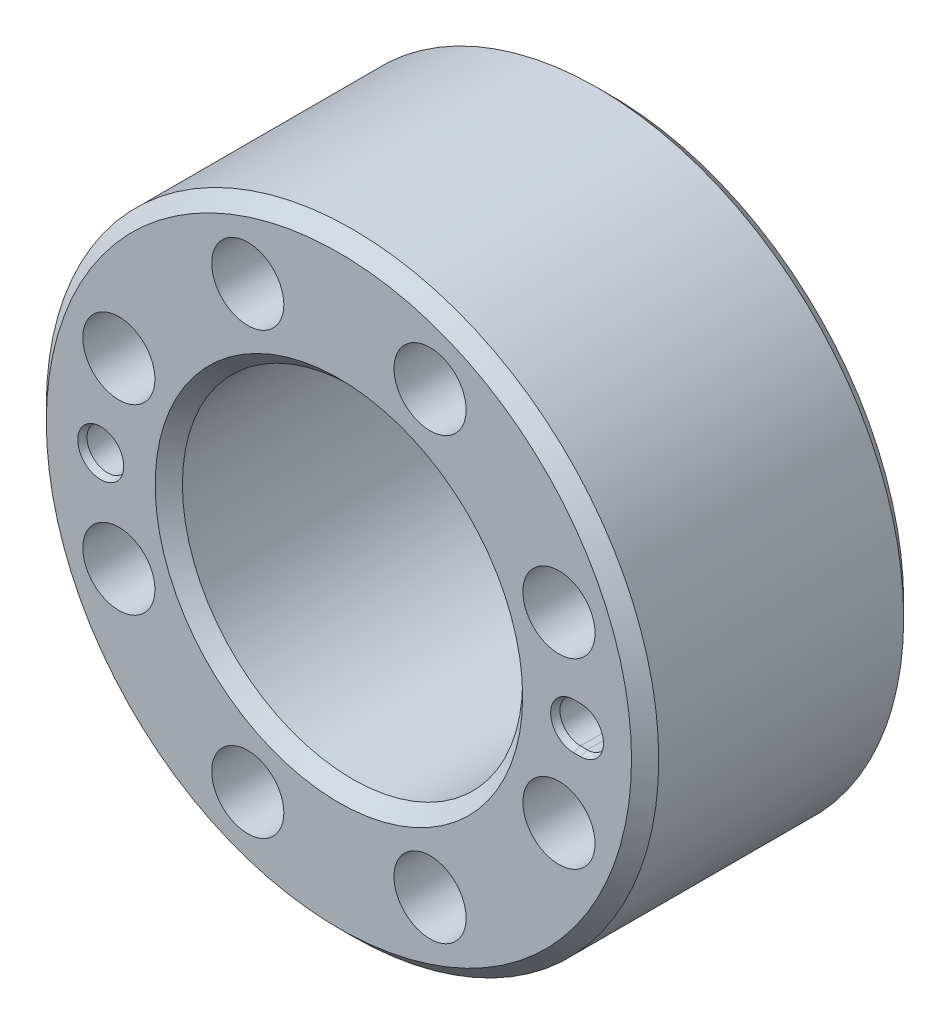
from build123d import *

# Parameters (mm, degrees)
SKETCH1_R                           = 22.5
SKETCH1_R_2                         = 12.5
BOSS_EXTRUDE1_DEPTH                 = 10
M5_CLEARANCE_HOLE1_D                = 5.3
F_3_0MM_CLEARANCE_DOWEL_HOLE1_D     = 3.016
F_3_0MM_CLEARANCE_DOWEL_HOLE1_DEPTH = 5
F_3_0MM_CLEARANCE_DOWEL_HOLE1_TIP   = 0.906097813
F_2_9_2_9_DIAMETER_HOLE1_D          = 2.9
F_2_9_2_9_DIAMETER_HOLE1_DEPTH      = 7
F_2_9_2_9_DIAMETER_HOLE1_TIP        = 0.871247898
CUT_EXTRUDE1_START                  = -5.906098
CUT_EXTRUDE1_DEPTH                  = 5.906098
CHAMFER1_SIZE                       = 1
CHAMFER2_SIZE                       = 0.181985117
CHAMFER2_SIZE_2                     = 0.5


with BuildPart() as part:
    # Sketch1 → Boss-Extrude1 (new, symmetric)
    with BuildSketch(Plane.XY):
        Circle(SKETCH1_R)
        Circle(SKETCH1_R_2, mode=Mode.SUBTRACT)
    extrude(amount=BOSS_EXTRUDE1_DEPTH, both=True)

    # M5 Clearance Hole1 (through all)
    with Locations(Plane.XY.offset(10)):
        with Locations((6.696960066, -16.167891819), (16.167891819, -6.696960066), (16.167891819, 6.696960066), (6.696960066, 16.167891819), (-6.696960066, 16.167891819), (-16.167891819, 6.696960066), (-16.167891819, -6.696960066), (-6.696960066, -16.167891819)):
            Hole(M5_CLEARANCE_HOLE1_D / 2)

    # Ø3.0mm Clearance Dowel Hole1
    with Locations(Plane.XY.offset(10)):
        with Locations((-17.5, 0), (17.5, 0)):
            Hole(F_3_0MM_CLEARANCE_DOWEL_HOLE1_D / 2, depth=F_3_0MM_CLEARANCE_DOWEL_HOLE1_DEPTH)
            with Locations((0, 0, -(F_3_0MM_CLEARANCE_DOWEL_HOLE1_DEPTH + F_3_0MM_CLEARANCE_DOWEL_HOLE1_TIP / 2))):  # 118° drill point
                Cone(0, F_3_0MM_CLEARANCE_DOWEL_HOLE1_D / 2, F_3_0MM_CLEARANCE_DOWEL_HOLE1_TIP, mode=Mode.SUBTRACT)

    # Ø2.9 (2.9) Diameter Hole1
    with Locations(Plane(origin=(0, 0, -10), x_dir=(-1, 0, 0), z_dir=(0, 0, -1))):
        with Locations((-17.5, 0), (17.5, 0)):
            Hole(F_2_9_2_9_DIAMETER_HOLE1_D / 2, depth=F_2_9_2_9_DIAMETER_HOLE1_DEPTH)
            with Locations((0, 0, -(F_2_9_2_9_DIAMETER_HOLE1_DEPTH + F_2_9_2_9_DIAMETER_HOLE1_TIP / 2))):  # 118° drill point
                Cone(0, F_2_9_2_9_DIAMETER_HOLE1_D / 2, F_2_9_2_9_DIAMETER_HOLE1_TIP, mode=Mode.SUBTRACT)

    # Sketch8 → Cut-Extrude1 (cut)
    with BuildSketch(Plane.XY.offset(10).offset(CUT_EXTRUDE1_START)):
        with BuildLine():
            Line((17.25, 1.508), (17.75, 1.508))
            ThreePointArc((17.75, 1.508), (19.258, 0), (17.75, -1.508))
            Line((17.75, -1.508), (17.25, -1.508))
            ThreePointArc((17.25, -1.508), (15.742, 0), (17.25, 1.508))
        make_face()
    extrude(amount=CUT_EXTRUDE1_DEPTH, mode=Mode.SUBTRACT)

    # Chamfer1
    chamfer1_edges = [part.edges().sort_by_distance(p)[0] for p in [
        (-22.5, 0, -10),
        (-22.5, 0, 10),
        (-12.5, 0, -10),
        (-12.5, 0, 10),
    ]]
    chamfer(chamfer1_edges, length=CHAMFER1_SIZE)

    # Chamfer2
    # the kernel refuses this chamfer: 0.5, 0.181985117 mm, written as the material it takes off along each edge
    with BuildSketch(Plane(origin=(-17.5, 0, 10), x_dir=(-1, 0, 0), z_dir=(0, -1, 0))) as chamfer2_piece_1:
        Polygon((1.508 + CHAMFER2_SIZE, 0), (1.508, CHAMFER2_SIZE_2), (1.508, 0), align=None)
    revolve(axis=Axis((-17.5, 0, 10), (0, 0, -1)), mode=Mode.SUBTRACT)
    with BuildSketch(Plane(origin=(-17.5, 0, -10), x_dir=(1, 0, 0), z_dir=(0, -1, 0))) as chamfer2_piece_2:
        Polygon((1.45 + CHAMFER2_SIZE, 0), (1.45, CHAMFER2_SIZE_2), (1.45, 0), align=None)
    revolve(axis=Axis((-17.5, 0, -10), (0, 0, 1)), mode=Mode.SUBTRACT)
    with BuildSketch(Plane(origin=(17.5, 0, -10), x_dir=(1, 0, 0), z_dir=(0, -1, 0))) as chamfer2_piece_3:
        Polygon((1.45 + CHAMFER2_SIZE, 0), (1.45, CHAMFER2_SIZE_2), (1.45, 0), align=None)
    revolve(axis=Axis((17.5, 0, -10), (0, 0, 1)), mode=Mode.SUBTRACT)
    with BuildSketch(Plane(origin=(17.75, -1.508, 10), x_dir=(0, -0.9950833631817482, 0.09904090225205342), z_dir=(-1, 0, 0)), Plane(origin=(17.5, 1.508, 10), x_dir=(0, 0.9950833631817482, 0.09904090225205342), z_dir=(1, 0, 0)), Plane(origin=(17.5, -1.508, 10), x_dir=(0, -0.9950833631817482, 0.09904090225205342), z_dir=(-1, 0, 0)), Plane(origin=(17.25, 1.508, 10), x_dir=(0, 0.9950833631817482, 0.09904090225205342), z_dir=(1, 0, 0))) as chamfer2_piece_4:
        Polygon((CHAMFER2_SIZE * 0.99508336391, -CHAMFER2_SIZE * 0.0990409023245), (-CHAMFER2_SIZE_2 * 0.0990409022521, -CHAMFER2_SIZE_2 * 0.995083363182), (0, 0), align=None)
    extrude(amount=0.25, mode=Mode.SUBTRACT)
    with BuildSketch(Plane(origin=(17.25, 0, 10), x_dir=(0, -1, 0), z_dir=(1, 0, 0))) as chamfer2_piece_5:
        Polygon((1.508 + CHAMFER2_SIZE, 0), (1.508, CHAMFER2_SIZE_2), (1.508, 0), align=None)
    revolve(axis=Axis((17.25, 0, 10), (0, 0, -1)), revolution_arc=180, mode=Mode.SUBTRACT)
    with BuildSketch(Plane(origin=(17.75, 0, 10), x_dir=(0, 1, 0), z_dir=(-1, 0, 0))) as chamfer2_piece_6:
        Polygon((1.508 + CHAMFER2_SIZE, 0), (1.508, CHAMFER2_SIZE_2), (1.508, 0), align=None)
    revolve(axis=Axis((17.75, 0, 10), (0, 0, -1)), revolution_arc=180, mode=Mode.SUBTRACT)


solid = part.part
